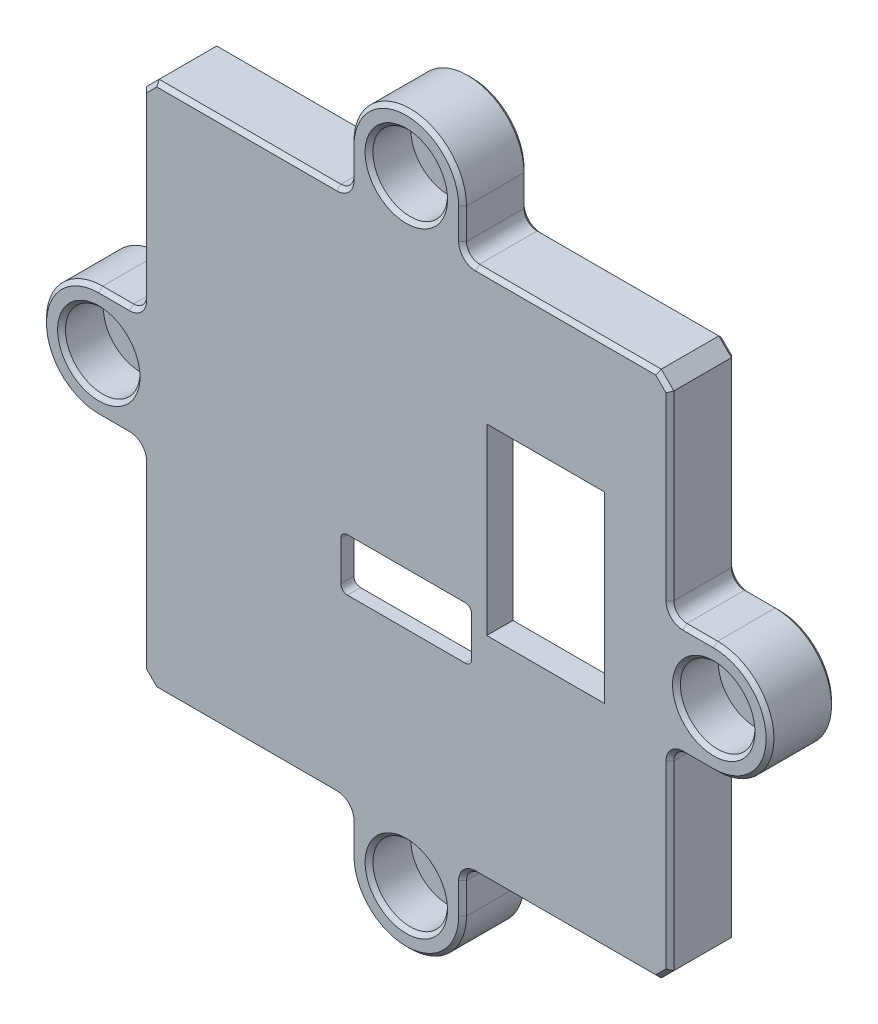
from build123d import *

# Parameters (mm, degrees)
SKETCH1_R           = 1.75
SKETCH1_W           = 9
SKETCH1_H           = 14
SKETCH1_W_2         = 10
SKETCH1_H_2         = 4
BOSS_EXTRUDE1_DEPTH = 5
FILLET3_R           = 0.5
SKETCH2_R           = 2.85
CUT_EXTRUDE1_DEPTH  = 3.2
SKETCH3_R           = 2.407181936
SKETCH3_R_2         = 2.340327513
SKETCH3_R_3         = 2.41187395
SKETCH3_R_4         = 2.413205516
BOSS_EXTRUDE2_DEPTH = 0.2
SKETCH4_W           = 35
SKETCH4_H           = 35
CUT_EXTRUDE2_DEPTH  = 4
SKETCH5_W           = 11
SKETCH5_H           = 16
SKETCH5_W_2         = 9
SKETCH5_H_2         = 14
BOSS_EXTRUDE3_DEPTH = 1
FILLET2_R           = 1
FILLET1_R           = 2
CHAMFER1_SIZE       = 0.3


with BuildPart() as part:
    # Sketch1 → Boss-Extrude1 (new body)
    with BuildSketch(Plane.XY):
        with BuildLine():
            Line((19.188334778, 20.15), (20.15, 19.188334778))
            Line((20.15, 19.188334778), (20.15, 4.3))
            Line((20.15, 4.3), (23.5, 4.3))
            ThreePointArc((23.5, 4.3), (27.8, 0), (23.5, -4.3))
            Line((23.5, -4.3), (20.15, -4.3))
            Line((20.15, -4.3), (20.15, -19.188334778))
            Line((20.15, -19.188334778), (19.188334778, -20.15))
            Line((19.188334778, -20.15), (4.3, -20.15))
            Line((4.3, -20.15), (4.3, -23.5))
            ThreePointArc((4.3, -23.5), (0, -27.8), (-4.3, -23.5))
            Line((-4.3, -23.5), (-4.3, -20.15))
            Line((-4.3, -20.15), (-19.188334778, -20.15))
            Line((-19.188334778, -20.15), (-20.15, -19.188334778))
            Line((-20.15, -19.188334778), (-20.15, -4.3))
            Line((-20.15, -4.3), (-23.5, -4.3))
            ThreePointArc((-23.5, -4.3), (-27.8, 0), (-23.5, 4.3))
            Line((-23.5, 4.3), (-20.15, 4.3))
            Line((-20.15, 4.3), (-20.15, 19.188334778))
            Line((-20.15, 19.188334778), (-19.188334778, 20.15))
            Line((-19.188334778, 20.15), (-4.3, 20.15))
            Line((-4.3, 20.15), (-4.3, 23.5))
            ThreePointArc((-4.3, 23.5), (0, 27.8), (4.3, 23.5))
            Line((4.3, 23.5), (4.3, 20.15))
            Line((4.3, 20.15), (19.188334778, 20.15))
        make_face()
        with Locations((0, 23.5)):
            Circle(SKETCH1_R, mode=Mode.SUBTRACT)
        with Locations((23.5, 0)):
            Circle(SKETCH1_R, mode=Mode.SUBTRACT)
        with Locations((0, -23.5)):
            Circle(SKETCH1_R, mode=Mode.SUBTRACT)
        with Locations((-23.5, 0)):
            Circle(SKETCH1_R, mode=Mode.SUBTRACT)
        with Locations((10.65, 3.15)):
            Rectangle(SKETCH1_W, SKETCH1_H, mode=Mode.SUBTRACT)
        with Locations((0, -4.5)):
            Rectangle(SKETCH1_W_2, SKETCH1_H_2, mode=Mode.SUBTRACT)
    extrude(amount=BOSS_EXTRUDE1_DEPTH)

    # Fillet3
    fillet3_edges = [part.edges().sort_by_distance(p)[0] for p in [
        (5, -6.5, 2.5),
        (-5, -6.5, 2.5),
        (-5, -2.5, 2.5),
        (5, -2.5, 2.5),
    ]]
    fillet(fillet3_edges, radius=FILLET3_R)

    # Sketch2 → Cut-Extrude1 (cut)
    with BuildSketch(Plane.XY.offset(5)):
        with Locations((0, 23.5)):
            Circle(SKETCH2_R)
        with Locations((23.5, 0)):
            Circle(SKETCH2_R)
        with Locations((-23.5, 0)):
            Circle(SKETCH2_R)
        with Locations((0, -23.5)):
            Circle(SKETCH2_R)
    extrude(amount=-CUT_EXTRUDE1_DEPTH, mode=Mode.SUBTRACT)

    # Sketch3 → Boss-Extrude2 (add)
    with BuildSketch(Plane.XY.offset(1.8)):
        with Locations((0, 23.5)):
            Circle(SKETCH3_R)
        with Locations((23.5, 0)):
            Circle(SKETCH3_R_2)
        with Locations((0, -23.5)):
            Circle(SKETCH3_R_3)
        with Locations((-23.5, 0)):
            Circle(SKETCH3_R_4)
    extrude(amount=-BOSS_EXTRUDE2_DEPTH)

    # Sketch4 → Cut-Extrude2 (cut)
    with BuildSketch(Plane(origin=(0, 0, 0), x_dir=(-1, 0, 0), z_dir=(0, 0, -1))):
        Rectangle(SKETCH4_W, SKETCH4_H)
    extrude(amount=-CUT_EXTRUDE2_DEPTH, mode=Mode.SUBTRACT)

    # Sketch5 → Boss-Extrude3 (add)
    with BuildSketch(Plane(origin=(0, 0, 4), x_dir=(-1, 0, 0), z_dir=(0, 0, -1))):
        with Locations((-10.65, 3.15)):
            Rectangle(SKETCH5_W, SKETCH5_H)
        with Locations((-10.65, 3.15)):
            Rectangle(SKETCH5_W_2, SKETCH5_H_2, mode=Mode.SUBTRACT)
    extrude(amount=BOSS_EXTRUDE3_DEPTH)

    # Fillet2
    fillet2_edges = [part.edges().sort_by_distance(p)[0] for p in [
        (-20.15, -4.3, 2.5),
        (-20.15, 4.3, 2.5),
        (-4.3, 20.15, 2.5),
        (4.3, 20.15, 2.5),
        (20.15, 4.3, 2.5),
        (20.15, -4.3, 2.5),
        (4.3, -20.15, 2.5),
        (-4.3, -20.15, 2.5),
    ]]
    fillet(fillet2_edges, radius=FILLET2_R)

    # Fillet1
    fillet1_edges = [part.edges().sort_by_distance(p)[0] for p in [
        (-17.5, -17.5, 2),
        (17.5, -17.5, 2),
        (17.5, 17.5, 2),
        (-17.5, 17.5, 2),
    ]]
    fillet(fillet1_edges, radius=FILLET1_R)

    # Chamfer1
    chamfer1_edges = [part.edges().sort_by_distance(p)[0] for p in [
        (-26.35, 0, 5),
        (-2.85, 23.5, 5),
        (20.65, 0, 5),
        (-2.85, -23.5, 5),
        (19.669167389, 19.669167389, 5),
        (20.15, 12.244167389, 5),
        (22.325, 4.3, 5),
        (27.8, 0, 5),
        (22.325, -4.3, 5),
        (20.15, -12.244167389, 5),
        (19.669167389, -19.669167389, 5),
        (12.244167389, -20.15, 5),
        (4.3, -22.325, 5),
        (0, -27.8, 5),
        (-4.3, -22.325, 5),
        (-12.244167389, -20.15, 5),
        (-19.669167389, -19.669167389, 5),
        (-20.15, -12.244167389, 5),
        (-22.325, -4.3, 5),
        (-27.8, 0, 5),
        (-22.325, 4.3, 5),
        (-20.15, 12.244167389, 5),
        (-19.669167389, 19.669167389, 5),
        (-12.244167389, 20.15, 5),
        (-4.3, 22.325, 5),
        (0, 27.8, 5),
        (4.3, 22.325, 5),
        (12.244167389, 20.15, 5),
        (-25.25, 0, 0),
        (-1.75, -23.5, 0),
        (21.75, 0, 0),
        (-1.75, 23.5, 0),
        (4.3, 22.325, 0),
        (0, 27.8, 0),
        (-4.3, 22.325, 0),
        (-12.244167389, 20.15, 0),
        (-19.669167389, 19.669167389, 0),
        (-20.15, 12.244167389, 0),
        (-22.325, 4.3, 0),
        (-27.8, 0, 0),
        (-22.325, -4.3, 0),
        (-20.15, -12.244167389, 0),
        (-19.669167389, -19.669167389, 0),
        (-12.244167389, -20.15, 0),
        (-4.3, -22.325, 0),
        (0, -27.8, 0),
        (4.3, -22.325, 0),
        (12.244167389, -20.15, 0),
        (19.669167389, -19.669167389, 0),
        (20.15, -12.244167389, 0),
        (22.325, -4.3, 0),
        (27.8, 0, 0),
        (22.325, 4.3, 0),
        (20.15, 12.244167389, 0),
        (19.669167389, 19.669167389, 0),
        (12.244167389, 20.15, 0),
        (16.914213562, 16.914213562, 0),
        (17.5, 0, 0),
        (16.914213562, -16.914213562, 0),
        (0, -17.5, 0),
        (-16.914213562, -16.914213562, 0),
        (-17.5, 0, 0),
        (-16.914213562, 16.914213562, 0),
        (0, 17.5, 0),
        (20.442893219, 4.592893219, 5),
        (20.442893219, -4.592893219, 5),
        (4.592893219, -20.442893219, 5),
        (-4.592893219, -20.442893219, 5),
        (-20.442893219, -4.592893219, 5),
        (-20.442893219, 4.592893219, 5),
        (-4.592893219, 20.442893219, 5),
        (4.592893219, 20.442893219, 5),
        (4.592893219, 20.442893219, 0),
        (-4.592893219, 20.442893219, 0),
        (-20.442893219, 4.592893219, 0),
        (-20.442893219, -4.592893219, 0),
        (-4.592893219, -20.442893219, 0),
        (4.592893219, -20.442893219, 0),
        (20.442893219, -4.592893219, 0),
        (20.442893219, 4.592893219, 0),
    ]]
    chamfer(chamfer1_edges, length=CHAMFER1_SIZE)


solid = part.part
